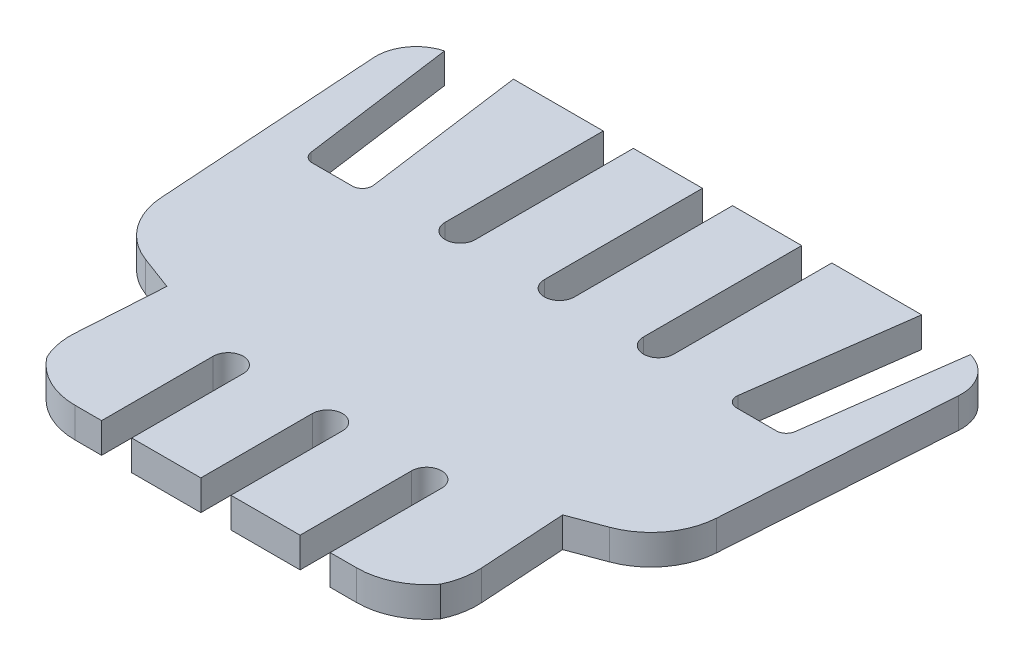
from build123d import *

# Parameters (mm, degrees)
BOSS_EXTRUDE1_DEPTH = 3
FILLET1_R           = 4
FILLET2_R           = 1
FILLET3_R           = 7


with BuildPart() as part:
    # Sketch1 → Boss-Extrude1 (new body)
    with BuildSketch(Plane(origin=(0, 0, 0), x_dir=(1, 0, 0), z_dir=(0, 1, 0))):
        with BuildLine():
            Line((-1.5, 15.76), (-1.5, 0))
            ThreePointArc((-1.5, 0), (0, -1.5), (1.5, 0))
            Line((1.5, 0), (1.5, 15.76))
            Line((1.5, 15.76), (8.39, 15.76))
            Line((8.39, 15.76), (8.39, 0))
            ThreePointArc((8.39, 0), (9.89, -1.5), (11.39, 0))
            Line((11.39, 0), (11.39, 15.76))
            Line((11.39, 15.76), (20.345, 15.76))
            Line((20.345, 15.76), (18, -1.5))
            Line((18, -1.5), (24, -1.5))
            Line((24, -1.5), (26.209136732, 14.76))
            Line((26.209136732, 14.76), (29.439136732, 14.76))
            Line((29.439136732, 14.76), (27.375, -16.54))
            Line((27.375, -16.54), (19.725, -19.4))
            Line((19.725, -19.4), (20.405, -30.24))
            Line((20.405, -30.24), (17.97, -34.24))
            Line((17.97, -34.24), (11.39, -34.24))
            Line((11.39, -34.24), (11.39, -23.125))
            ThreePointArc((11.39, -23.125), (9.89, -21.625), (8.39, -23.125))
            Line((8.39, -23.125), (8.39, -34.24))
            Line((8.39, -34.24), (1.5, -34.24))
            Line((1.5, -34.24), (1.5, -23.125))
            ThreePointArc((1.5, -23.125), (0, -21.625), (-1.5, -23.125))
            Line((-1.5, -23.125), (-1.5, -34.24))
            Line((-1.5, -34.24), (-8.39, -34.24))
            Line((-8.39, -34.24), (-8.39, -23.125))
            ThreePointArc((-8.39, -23.125), (-9.89, -21.625), (-11.39, -23.125))
            Line((-11.39, -23.125), (-11.39, -34.24))
            Line((-11.39, -34.24), (-17.97, -34.24))
            Line((-17.97, -34.24), (-20.405, -30.24))
            Line((-20.405, -30.24), (-19.725, -19.4))
            Line((-19.725, -19.4), (-27.375, -16.54))
            Line((-27.375, -16.54), (-29.439136732, 14.76))
            Line((-29.439136732, 14.76), (-26.209136732, 14.76))
            Line((-26.209136732, 14.76), (-24, -1.5))
            Line((-24, -1.5), (-18, -1.5))
            Line((-18, -1.5), (-20.345, 15.76))
            Line((-20.345, 15.76), (-11.39, 15.76))
            Line((-11.39, 15.76), (-11.39, 0))
            ThreePointArc((-11.39, 0), (-9.89, -1.5), (-8.39, 0))
            Line((-8.39, 0), (-8.39, 15.76))
            Line((-8.39, 15.76), (-1.5, 15.76))
        make_face()
    extrude(amount=BOSS_EXTRUDE1_DEPTH)

    # Fillet1
    # the kernel refuses this fillet: 4 mm, written as the material it takes off along each edge
    with BuildSketch(Plane(origin=(-29.439136732, -10.340886874, -14.76), x_dir=(0.0658039254405357, 0, 0.9978325728280353), z_dir=(0, 1, 0))) as fillet1_piece_1:
        with BuildLine():
            CenterArc((4.136354749, 4), FILLET1_R, 191.20092555, 78.79907445)
            Line((0.212546679, 3.22299921), (0.134070518, 3.207459194))
            ThreePointArc((0.134070518, 3.207459194), (0.026446734, 1.616763919), (-0.079826606, 0.005264314))
            Line((-0.079826606, 0.005264314), (0, -0.08))
            Line((0, -0.08), (4.136354749, -0.08))
            Line((4.136354749, -0.08), (4.136354749, 0))
        make_face()
    extrude(amount=23.681773747, mode=Mode.SUBTRACT)
    with BuildSketch(Plane(origin=(29.439136732, -10.340886874, -14.76), x_dir=(-1, 0, 0), z_dir=(0, 1, 0))) as fillet1_piece_2:
        with BuildLine():
            CenterArc((4.263518671, 3.8641738), FILLET1_R, 176.226986492, 78.79907445)
            Line((0.27218838, 4.127389502), (0.192361774, 4.132653816))
            Line((0.192361774, 4.132653816), (-0.079826606, 0.005264314))
            Line((-0.079826606, 0.005264314), (0, -0.08))
            ThreePointArc((0, -0.08), (1.615, -0.08), (3.209329627, -0.077283476))
            Line((3.209329627, -0.077283476), (3.23, 0))
        make_face()
    extrude(amount=23.681773747, mode=Mode.SUBTRACT)

    # Fillet2
    fillet2_edges = [part.edges().sort_by_distance(p)[0] for p in [
        (18, 1.5, 1.5),
        (24, 1.5, 1.5),
        (-24, 1.5, 1.5),
        (-18, 1.5, 1.5),
    ]]
    fillet(fillet2_edges, radius=FILLET2_R)

    # Fillet3
    # the kernel refuses this fillet: 7 mm, written as the material it takes off along each edge
    with BuildSketch(Plane(origin=(-17.97, -9.834409558, 34.24), x_dir=(-0.5199808190603049, 0, -0.8541779368547132), z_dir=(0, 1, 0)), Plane(origin=(17.97, -9.834409558, 34.24), x_dir=(-1, 0, 0), z_dir=(0, 1, 0))) as fillet3_piece_1:
        with BuildLine():
            CenterArc((FILLET3_R * 0.561966260458, -FILLET3_R), FILLET3_R, 90, 58.669035113)
            Line((-FILLET3_R * 0.292211676397, -FILLET3_R * 0.48001918094), (0, 0))
            Line((0, 0), (FILLET3_R * 0.561966260458, 0))
        make_face()
    extrude(amount=22.668819116, mode=Mode.SUBTRACT)
    with BuildSketch(Plane(origin=(-20.405, -5.504377364, 30.24), x_dir=(0.06260756375388789, 0, -0.998038222194322), z_dir=(0, 1, 0)), Plane(origin=(20.405, -5.504377364, 30.24), x_dir=(-0.5199808190603047, 0, 0.8541779368547133), z_dir=(0, 1, 0))) as fillet3_piece_2:
        with BuildLine():
            CenterArc((FILLET3_R * 0.314535849376, -FILLET3_R), FILLET3_R, 90, 34.920461628)
            Line((-FILLET3_R * 0.257902882493, -FILLET3_R * 0.180052502744), (0, 0))
            Line((0, 0), (FILLET3_R * 0.314535849376, 0))
        make_face()
    extrude(amount=14.008754728, mode=Mode.SUBTRACT)
    with BuildSketch(Plane(origin=(-27.375, -11.305757053, 16.54), x_dir=(-0.06580392544053615, 0, -0.9978325728280353), z_dir=(0, 1, 0)), Plane(origin=(27.375, -11.305757053, 16.54), x_dir=(-0.9366809367224829, 0, 0.3501839841864447), z_dir=(0, 1, 0))) as fillet3_piece_3:
        with BuildLine():
            CenterArc((FILLET3_R * 0.646043260189, -FILLET3_R), FILLET3_R, 90, 65.728417673)
            Line((-FILLET3_R * 0.265564008034, -FILLET3_R * 0.588937731574), (0, 0))
            Line((0, 0), (FILLET3_R * 0.646043260189, 0))
        make_face()
    extrude(amount=25.611514107, mode=Mode.SUBTRACT)


solid = part.part
